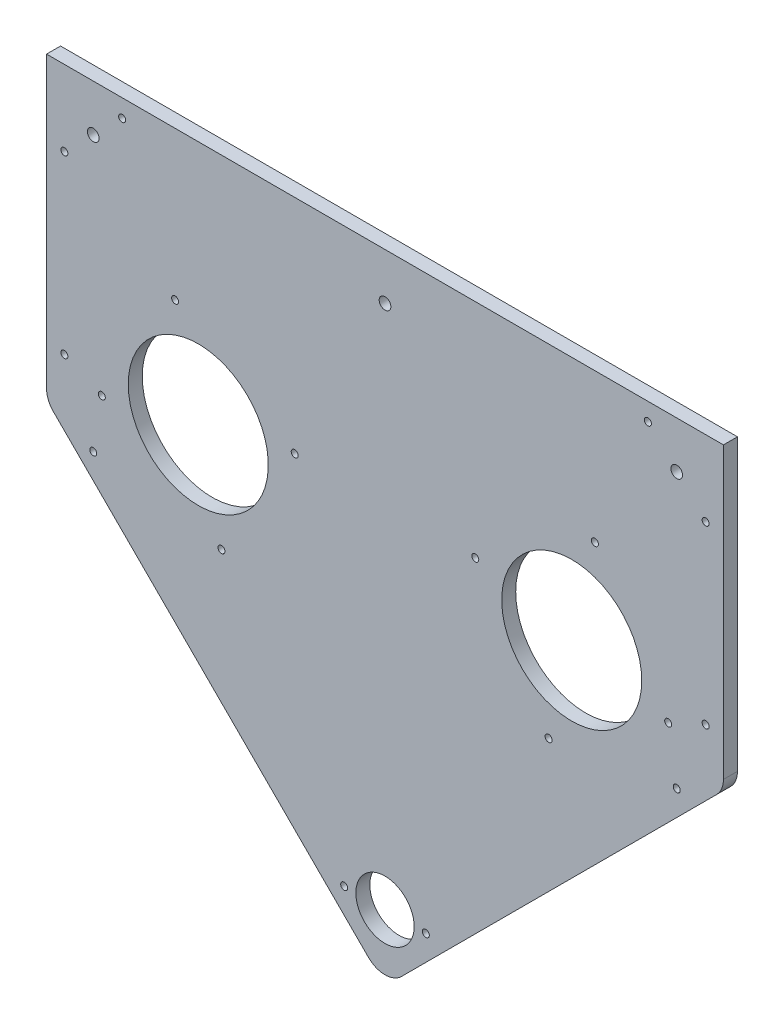
from build123d import *

# Parameters (mm, degrees)
SKETCH1_R           = 12.5
SKETCH1_R_2         = 1.5
SKETCH1_R_3         = 2.5
BOSS_EXTRUDE1_DEPTH = 6
FILLET1_R           = 10
SKETCH2_R           = 1.5
SKETCH2_R_2         = 30
CUT_EXTRUDE1_DEPTH  = 10


with BuildPart() as part:
    # Sketch1 → Boss-Extrude1 (new body)
    with BuildSketch(Plane.XY):
        Polygon((-145, 120), (145, 120), (145, -8.284271247), (0, -153.284271247), (-145, -8.284271247), align=None)
        with Locations((0, -125)):
            Circle(SKETCH1_R, mode=Mode.SUBTRACT)
        with Locations((-137.374368671, 87.625631329)):
            Circle(SKETCH1_R_2, mode=Mode.SUBTRACT)
        with Locations((-112.625631329, 112.374368671)):
            Circle(SKETCH1_R_2, mode=Mode.SUBTRACT)
        with Locations((-137.374368671, 12.374368671)):
            Circle(SKETCH1_R_2, mode=Mode.SUBTRACT)
        with Locations((-125, -17.5)):
            Circle(SKETCH1_R_2, mode=Mode.SUBTRACT)
        with Locations((-17.5, -125)):
            Circle(SKETCH1_R_2, mode=Mode.SUBTRACT)
        with Locations((17.5, -125)):
            Circle(SKETCH1_R_2, mode=Mode.SUBTRACT)
        with Locations((125, -17.5)):
            Circle(SKETCH1_R_2, mode=Mode.SUBTRACT)
        with Locations((137.374368671, 12.374368671)):
            Circle(SKETCH1_R_2, mode=Mode.SUBTRACT)
        with Locations((137.374368671, 87.625631329)):
            Circle(SKETCH1_R_2, mode=Mode.SUBTRACT)
        with Locations((112.625631329, 112.374368671)):
            Circle(SKETCH1_R_2, mode=Mode.SUBTRACT)
        with Locations((0, 100)):
            Circle(SKETCH1_R_3, mode=Mode.SUBTRACT)
        with Locations((-125, 100)):
            Circle(SKETCH1_R_3, mode=Mode.SUBTRACT)
        with Locations((125, 100)):
            Circle(SKETCH1_R_3, mode=Mode.SUBTRACT)
    extrude(amount=BOSS_EXTRUDE1_DEPTH)

    # Fillet1
    fillet1_edges = [part.edges().sort_by_distance(p)[0] for p in [
        (-145, -8.284271247, 3),
        (145, -8.284271247, 3),
        (0, -153.284271247, 3),
    ]]
    fillet(fillet1_edges, radius=FILLET1_R)

    # Sketch2 → Cut-Extrude1 (cut)
    with BuildSketch(Plane.XY.offset(6)):
        with Locations((38.67402397, 24.920368197)):
            Circle(SKETCH2_R)
        with Locations((89.920368197, 56.32597603)):
            Circle(SKETCH2_R)
        with Locations((121.32597603, 5.079631803)):
            Circle(SKETCH2_R)
        with Locations((70.079631803, -26.32597603)):
            Circle(SKETCH2_R)
        with Locations((80, 15)):
            Circle(SKETCH2_R_2)
        with Locations((-38.67402397, 24.920368197)):
            Circle(SKETCH2_R)
        with Locations((-89.920368197, 56.32597603)):
            Circle(SKETCH2_R)
        with Locations((-70.079631803, -26.32597603)):
            Circle(SKETCH2_R)
        with Locations((-121.32597603, 5.079631803)):
            Circle(SKETCH2_R)
        with Locations((-80, 15)):
            Circle(SKETCH2_R_2)
    extrude(amount=-CUT_EXTRUDE1_DEPTH, mode=Mode.SUBTRACT)


solid = part.part
